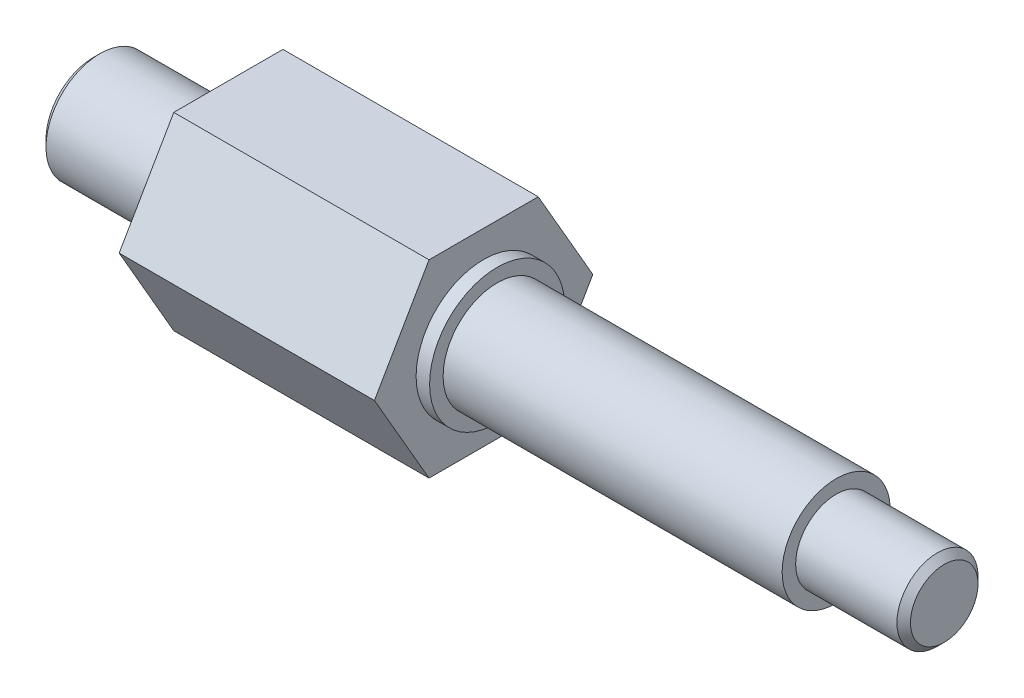
from build123d import *

# Parameters (mm, degrees)
BOSS_EXTRUDE1_START = -10
BOSS_EXTRUDE1_DEPTH = 63
CHAMFER1_SIZE       = 0.5


# Read off the part's stored shape, not the designer's step: Boss-Extrude1
with BuildPart() as part:
    # Boss-Extrude1 outline → Boss-Extrude1 (new body)
    with BuildSketch(Plane(origin=(0, 0, 0), x_dir=(0, 0, -1), z_dir=(1, 0, 0)).offset(BOSS_EXTRUDE1_START)):
        Polygon((-4.04145, 6.999996736), (-8.0829, 0), (-4.04145, -6.999996736), (4.04145, -6.999996736), (8.0829, 0), (4.04145, 6.999996736), align=None)
    extrude(amount=BOSS_EXTRUDE1_DEPTH)

    # Sketch2 → Cut-Revolve1 (revolve, cut)
    with BuildSketch(Plane(origin=(0, 0, 0), x_dir=(1, 0, 0), z_dir=(0, 1, 0)), mode=Mode.PRIVATE) as cut_revolve1_sk:
        Polygon((0, 8.0829), (-10, 8.0829), (-10, 4), (-1, 4), (-1, 3.45), (0, 3.45), align=None)
    revolve(cut_revolve1_sk.sketch.rotate(Axis((-12.627683811, 0, 0), (1, 0, 0)), 180), axis=Axis((-12.627683811, 0, 0), (1, 0, 0)), mode=Mode.SUBTRACT)

    # Sketch3 → Cut-Revolve2 (revolve, cut)
    with BuildSketch(Plane(origin=(0, 0, 0), x_dir=(1, 0, 0), z_dir=(0, 1, 0)), mode=Mode.PRIVATE) as cut_revolve2_sk:
        Polygon((53, 8.0829), (53, 3), (45, 3), (45, 4), (19.9, 4), (19.9, 5), (18.9, 5), (18.9, 8.0829), align=None)
    revolve(cut_revolve2_sk.sketch.rotate(Axis((-14.24617289, 0, 0), (1, 0, 0)), 180), axis=Axis((-14.24617289, 0, 0), (1, 0, 0)), mode=Mode.SUBTRACT)

    # Chamfer1
    chamfer1_edges = [part.edges().sort_by_distance(p)[0] for p in [
        (-10, 0, -4),
        (53, 0, -3),
    ]]
    chamfer(chamfer1_edges, length=CHAMFER1_SIZE)


solid = part.part
